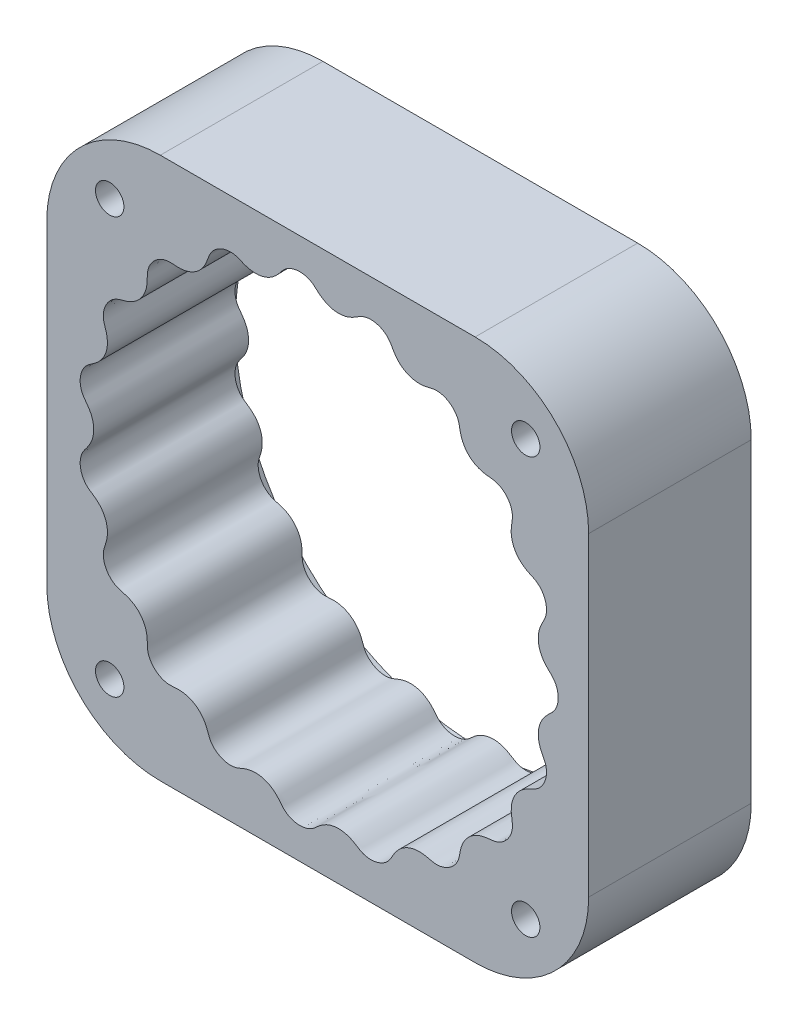
from build123d import *

# Parameters (mm, degrees)
BOSS_EXTRUDE1_START     = -15
BOSS_EXTRUDE1_OUTLINE_W = 105
BOSS_EXTRUDE1_OUTLINE_H = 105
BOSS_EXTRUDE1_DEPTH     = 30
FILLET1_R               = 22
SKETCH3_R               = 47.5
BOSS_EXTRUDE2_DEPTH     = 1.5
M5_CLEARANCE_HOLE1_D    = 5.5


# Read off the part's stored shape, not the designer's step: Boss-Extrude1
with BuildPart() as part:
    # Boss-Extrude1 outline → Boss-Extrude1 (new body)
    with BuildSketch(Plane.XY.offset(BOSS_EXTRUDE1_START)):
        Rectangle(BOSS_EXTRUDE1_OUTLINE_W, BOSS_EXTRUDE1_OUTLINE_H)
        with BuildLine():
            add(Edge.make_bspline(
                [(46.6, 0), (46.6, 0.029087461), (46.599364612, 0.087257129), (46.596505374, 0.189641599), (46.588879748, 0.333882329), (46.577439121, 0.472245688), (46.562181605, 0.604872273), (46.543105311, 0.736757111), (46.520205715, 0.869043535), (46.486793745, 1.034170725), (46.439000291, 1.230350248), (46.353070581, 1.520585204), (46.187608886, 1.948385058), (45.914553276, 2.462387961), (45.539034763, 2.944331255), (45.129326083, 3.33695268), (44.714883503, 3.72361592), (44.198622495, 4.235491045), (43.580390842, 5.003267586), (43.019635917, 6.085802978), (42.70540379, 7.399867904), (42.709511206, 8.517145629), (42.869182264, 9.382721248), (43.072025934, 10.026910788), (43.246298223, 10.466491915), (43.448090078, 10.894056312), (43.668303415, 11.312056785), (43.890460635, 11.729115857), (44.081486543, 12.162206318), (44.230509691, 12.646282797), (44.322254654, 13.17793841), (44.350269351, 13.901303309), (44.225980004, 14.785484309), (43.876469959, 15.753952549), (43.328261092, 16.571354837), (42.768276951, 17.118887669), (42.275218646, 17.463336276), (41.905394974, 17.668576571), (41.521608513, 17.845226332), (41.135800326, 18.016913299), (40.659736215, 18.245477721), (40.000488409, 18.617770316), (39.211352323, 19.215530447), (38.390031463, 20.155740794), (37.755372598, 21.401023427), (37.481291974, 22.6293171), (37.470138146, 23.643544264), (37.553204291, 24.3880984), (37.628385857, 24.871024236), (37.689307277, 25.25722304), (37.742949817, 25.743362292), (37.736273109, 26.407348831), (37.569014003, 27.23186091), (37.142972639, 28.180724435), (36.537210357, 28.966027778), (35.883456351, 29.532147771), (35.277085835, 29.895071779), (34.793981515, 30.10527269), (34.319162875, 30.244730454), (33.863161615, 30.323576928), (33.40313321, 30.366596235), (32.943171832, 30.408516422), (32.484935629, 30.468628109), (32.03098993, 30.556165837), (31.349481898, 30.737428845), (30.468549449, 31.097990168), (29.517636227, 31.727587687), (28.726402343, 32.591405442), (28.227269822, 33.404807425), (27.928053926, 34.083475509), (27.741981913, 34.646648529), (27.621495158, 35.151246838), (27.540892191, 35.588105319), (27.46407256, 36.025537396), (27.369150784, 36.504337733), (27.180106222, 37.082688092), (26.833292886, 37.722160757), (26.352791657, 38.324287786), (25.720738212, 38.890346654), (24.928043822, 39.373543485), (24.047894654, 39.686381568), (23.215360253, 39.78729997), (22.554927394, 39.741939088), (22.076027287, 39.650264034), (21.697241263, 39.55831848), (21.223758534, 39.443418722), (20.491270286, 39.297697162), (19.483061541, 39.221365323), (18.237383811, 39.38671866), (16.9412821, 39.909449178), (15.931398173, 40.646304358), (15.265420547, 41.382957669), (14.836701001, 42.009807629), (14.567886647, 42.466205551), (14.364116276, 42.8375367), (14.156406596, 43.206851773), (13.92202596, 43.560461381), (13.629057317, 43.916130741), (13.27011591, 44.260374073), (12.727767821, 44.664759759), (11.948159371, 45.061481341), (11.09271343, 45.294077816), (10.202357254, 45.34680237), (9.485549687, 45.261338322), (8.964345806, 45.12813622), (8.494853492, 44.941959947), (8.079335521, 44.71804952), (7.68280732, 44.463457476), (7.285877828, 44.209748252), (6.878169469, 43.97304101), (6.456372041, 43.762329426), (5.833872308, 43.505386686), (4.987909175, 43.271745962), (3.876320491, 43.169819966), (2.539162677, 43.367535142), (1.409790188, 43.832381738), (0.588840645, 44.384000745), (0.033206999, 44.856327151), (-0.317522366, 45.17488567), (-0.600518674, 45.427162793), (-0.972085052, 45.721875048), (-1.527217323, 46.062503501), (-2.303235928, 46.359067305), (-3.298726206, 46.505710733), (-4.380312925, 46.418186837), (-5.336697925, 46.114804242), (-6.051490182, 45.701544497), (-6.543432506, 45.28061924), (-6.862182092, 44.93308185), (-7.099467465, 44.640145681), (-7.390965094, 44.270087148), (-7.85580291, 43.714144886), (-8.564983, 43.034238721), (-9.645305925, 42.348851824), (-11.053671018, 41.900713757), (-12.399361948, 41.847716086), (-13.477212764, 42.054859944), (-14.248747763, 42.321200786), (-14.748329849, 42.528078612), (-15.144725128, 42.700651944), (-15.54804898, 42.857976029), (-15.964827464, 42.976465966), (-16.424561869, 43.054831219), (-16.923509929, 43.080933138), (-17.596231206, 43.034608683), (-18.424859211, 42.836591729), (-19.330531401, 42.418208159), (-20.084149678, 41.819645132), (-20.583925648, 41.219723741), (-20.887529946, 40.702592125), (-21.062460409, 40.318882171), (-21.207179109, 39.923272014), (-21.345795171, 39.525730848), (-21.532751901, 39.033537922), (-21.846234916, 38.346942265), (-22.371718452, 37.51158873), (-23.235224483, 36.612351462), (-24.420037522, 35.870640193), (-25.621445103, 35.489625147), (-26.634100057, 35.390458765), (-27.385338694, 35.409912071), (-27.874415543, 35.444435486), (-28.265423903, 35.473940863), (-28.657808638, 35.485591011), (-29.049922684, 35.462778276), (-29.609443499, 35.375052303), (-30.317114974, 35.149276757), (-31.143352348, 34.695078612), (-31.877513229, 34.027785471), (-32.388692105, 33.331175607), (-32.701134403, 32.699553889), (-32.871878953, 32.202639001), (-32.97315823, 31.719649794), (-33.015706635, 31.260070917), (-33.021315439, 30.799307278), (-33.02466199, 30.338714031), (-33.045665963, 29.878295211), (-33.093911831, 29.419780471), (-33.215495563, 28.727116861), (-33.497441819, 27.820770261), (-34.040704398, 26.819690287), (-34.831315921, 25.956095904), (-35.598629525, 25.387101875), (-36.250805729, 25.028894083), (-36.797567632, 24.794179621), (-37.291610194, 24.630493146), (-37.721505444, 24.513048501), (-38.152484082, 24.400066194), (-38.623629338, 24.266873639), (-39.187164279, 24.032432169), (-39.799081301, 23.634769785), (-40.36260276, 23.106034759), (-40.876472492, 22.429627339), (-41.293889066, 21.600960829), (-41.534535207, 20.700182313), (-41.568863522, 19.864910481), (-41.472077943, 19.212101178), (-41.343195847, 18.743379247), (-41.221082694, 18.374466146), (-41.067537268, 17.913659669), (-40.860647334, 17.198463746), (-40.697949644, 16.20379394), (-40.752236204, 14.982678894), (-41.130058644, 13.706086002), (-41.724378981, 12.666920056), (-42.346630019, 11.949944985), (-42.914545599, 11.453911918), (-43.36570477, 11.12002078), (-43.737705228, 10.868799961), (-44.112515882, 10.621938918), (-44.473001401, 10.353649668), (-44.937026241, 9.925564315), (-45.432780332, 9.276484551), (-45.85982989, 8.361475204), (-46.054645226, 7.332730317), (-46.035304424, 6.433680211), (-45.893339269, 5.728053082), (-45.719711363, 5.220475217), (-45.497784051, 4.768435111), (-45.242562272, 4.372936441), (-44.95746402, 3.999425043), (-44.672243636, 3.626196511), (-44.40255798, 3.241183513), (-44.157159078, 2.84014718), (-43.848370672, 2.243882141), (-43.542926044, 1.423779601), (-43.349852638, 0.35773357), (-43.41587872, -0.928193685), (-43.73968724, -2.052127744), (-44.170903187, -2.895110464), (-44.576050773, -3.495305807), (-44.879637417, -3.89865098), (-45.126068462, -4.218516436), (-45.35995448, -4.5481038), (-45.564196947, -4.897255034), (-45.748344007, -5.300034028), (-45.898352022, -5.757510539), (-46.028291706, -6.404246465), (-46.056011502, -7.232679593), (-45.90360822, -8.181146762), (-45.52189926, -9.116043895), (-45.054559895, -9.793605367), (-44.597609809, -10.24958302), (-44.227060272, -10.539109333), (-43.916808035, -10.751390924), (-43.52497417, -11.010478179), (-42.933523203, -11.425186638), (-42.197462177, -12.070967255), (-41.440263105, -13.061334193), (-40.885173083, -14.362848438), (-40.692886921, -15.644152631), (-40.767518554, -16.697924706), (-40.942569439, -17.489922394), (-41.107078592, -18.036262169), (-41.253264472, -18.468374312), (-41.393334913, -18.902831626), (-41.495247263, -19.348527803), (-41.549342916, -19.834203374), (-41.543240717, -20.354477429), (-41.447101521, -21.045513367), (-41.182339935, -21.872942564), (-40.688480135, -22.753100501), (-40.026775362, -23.461012396), (-39.390948583, -23.910155699), (-38.853107879, -24.171270732), (-38.457982178, -24.314997399), (-38.053197956, -24.42708195), (-37.64675139, -24.531900087), (-37.142038149, -24.676194717), (-36.433328318, -24.928930554), (-35.558308552, -25.37866609), (-34.612604024, -26.139482406), (-33.800095265, -27.197967509), (-33.310413145, -28.303671653), (-33.100747534, -29.256890066), (-33.035961406, -30.000647108), (-33.022448287, -30.521436434), (-33.020934216, -30.93802916), (-33.009240784, -31.354767139), (-32.963258516, -31.769568685), (-32.867143359, -32.212481315), (-32.70932044, -32.675502609), (-32.420302687, -33.274873428), (-31.925261302, -33.974666151), (-31.293487791, -34.568413067), (-30.55221464, -35.025449505), (-29.899465003, -35.285698973), (-29.391987449, -35.416124968), (-28.903859788, -35.478809394), (-28.443598193, -35.485005889), (-27.985109803, -35.453423757), (-27.527108489, -35.418415053), (-27.067822527, -35.400390013), (-26.608126306, -35.409213019), (-25.909508979, -35.47055211), (-24.98474332, -35.672196203), (-24.058287402, -36.074386773), (-23.195282906, -36.694531458), (-22.580291821, -37.315387153), (-22.157905423, -37.859866122), (-21.794223425, -38.462181376), (-21.532014308, -39.028926658), (-21.340816844, -39.539132067), (-21.187475413, -39.979029037), (-21.056859249, -40.328370888), (-20.864525811, -40.753337701), (-20.531775511, -41.300446627), (-19.989267547, -41.910606678), (-19.186680674, -42.495885748), (-18.198742075, -42.920563184), (-17.211451966, -43.100880124), (-16.378692256, -43.068800628), (-15.737516589, -42.921511161), (-15.281814566, -42.756475638), (-14.925149692, -42.60523728), (-14.480127692, -42.414385226), (-13.787294208, -42.148238149), (-12.813514375, -41.900951627), (-11.610585016, -41.8490742), (-10.337588254, -42.101694414), (-9.371648719, -42.533226002), (-8.689955807, -42.983804945), (-8.196993057, -43.400015536), (-7.857883944, -43.732357261), (-7.541689551, -44.086448454), (-7.243389355, -44.455410771), (-6.951486554, -44.829275853), (-6.637732453, -45.186083686), (-6.161065809, -45.618271953), (-5.471404128, -46.052289652), (-4.531729166, -46.394678261), (-3.506503098, -46.501851967), (-2.620959945, -46.411145903), (-1.930900495, -46.213866602), (-1.440101883, -46.001165413), (-1.008199144, -45.745055861), (-0.635068333, -45.460312519), (-0.286844081, -45.146791783), (0.060207743, -44.832270735), (0.419910008, -44.531752914), (0.797329731, -44.25367963), (1.363115268, -43.89565228), (2.151225627, -43.521133486), (3.069293267, -43.270129879), (4.090579929, -43.200885347), (4.980606689, -43.29020225), (5.727321282, -43.469288679), (6.350058033, -43.707681041), (6.855325115, -43.960392245), (7.256207697, -44.193670366), (7.56371739, -44.386746445), (7.868672957, -44.583634275), (8.178964683, -44.772524983), (8.582222823, -44.981743841), (9.166600108, -45.201750997), (9.949755718, -45.347735369), (10.923921168, -45.323373972), (11.952107252, -45.065605809), (12.833911886, -44.619777654), (13.470166718, -44.101700977), (13.887500425, -43.61186031), (14.146152239, -43.220867431), (14.332190277, -42.895531723), (14.557243566, -42.484873602), (14.919162012, -41.862371902), (15.497147725, -41.075873712), (16.4161953, -40.236326862), (17.663787326, -39.569177797), (18.924969634, -39.265079517), (19.984296654, -39.248036928), (20.790665402, -39.354825599), (21.350506246, -39.472829745), (21.794510371, -39.582831296), (22.240028089, -39.68772929), (22.693582681, -39.754434092), (23.183377617, -39.770095592), (23.702981116, -39.722604435), (24.386071642, -39.571145789), (25.190286121, -39.240311492), (26.027383048, -38.677318298), (26.678987062, -37.961788991), (27.074960175, -37.294299359), (27.292215643, -36.739219006), (27.404045113, -36.335200727), (27.483006235, -35.92392845), (27.553549291, -35.511428803), (27.654424697, -34.997885182), (27.844965155, -34.272385809), (28.216031148, -33.364564212), (28.890156642, -32.357356991), (29.873150236, -31.454965885), (30.93330336, -30.86952139), (31.867741284, -30.577154216), (32.605510667, -30.448558397), (33.124863271, -30.391003117), (33.541144212, -30.354903797), (33.956818374, -30.309694973), (34.367931711, -30.230977638), (34.803195622, -30.099848837), (35.253601598, -29.90522522), (35.829727895, -29.568264887), (36.488107619, -29.017933528), (37.028982636, -28.340300749), (37.42448219, -27.565387247), (37.631175985, -26.895822302), (37.720680075, -26.381032737), (37.744597382, -25.890842805), (37.714613789, -25.432758415), (37.646300663, -24.979522235), (37.573425558, -24.527290993), (37.516725603, -24.072414827), (37.486293382, -23.614930216), (37.487260776, -22.915541514), (37.607562747, -21.979511393), (37.981612168, -20.85779432), (38.75276426, -19.671691071), (39.666787707, -18.828038809), (40.49797482, -18.319456761), (41.147514954, -18.011443702), (41.574633246, -17.821431654), (41.913461312, -17.662773755), (42.323315352, -17.436839115), (42.844274796, -17.060923449), (43.411203534, -16.469707776), (43.926938672, -15.627817301), (44.267717023, -14.624106896), (44.371412297, -13.654409652), (44.289189571, -12.86067167), (44.116674888, -12.259464523), (43.940306734, -11.83997082), (43.777015952, -11.514793846), (43.562751259, -11.113971502), (43.309988076, -10.619280631), (43.05517887, -10.013283664), (42.844797238, -9.283975605), (42.729731478, -8.52355349), (42.715951334, -7.579290135), (42.900450934, -6.470843349), (43.332715359, -5.412563918), (43.929519137, -4.551669803), (44.45547596, -3.977875104), (44.82489899, -3.620051543), (45.126415876, -3.340387906), (45.421283365, -3.053265717), (45.69235234, -2.743053666), (45.950494641, -2.378605209), (46.149409688, -2.017298355), (46.298553136, -1.66994977), (46.396529934, -1.377009003), (46.451827543, -1.178574091), (46.491256037, -1.01123335), (46.518796895, -0.876853704), (46.542321479, -0.742815133), (46.561861492, -0.608228856), (46.577557899, -0.468108615), (46.589452906, -0.321119434), (46.595248795, -0.216114461), (46.597500878, -0.156808149), (46.598296327, -0.127135709)],
                knots=[0.067476216, 0.067476216, 0.067476216, 0.067476216, 0.067476216, 0.067844778, 0.06821334, 0.068581902, 0.068950464, 0.069319026, 0.069687588, 0.07005615, 0.070424712, 0.071161836, 0.07189896, 0.073373208, 0.075444729, 0.077516251, 0.078552011, 0.079587772, 0.081659293, 0.085482409, 0.089305525, 0.092815775, 0.096326026, 0.097620812, 0.098915599, 0.100210386, 0.101505173, 0.10279996, 0.104094747, 0.105389533, 0.10668432, 0.108337983, 0.109991645, 0.11329897, 0.116406241, 0.119513511, 0.120670895, 0.121828278, 0.122985661, 0.124143044, 0.125300428, 0.126457811, 0.128772577, 0.132431495, 0.136090414, 0.14001233, 0.143934247, 0.146077059, 0.147148466, 0.148219872, 0.149291278, 0.150362685, 0.152505497, 0.155469761, 0.158434024, 0.161661995, 0.163275981, 0.164889966, 0.166155807, 0.167421649, 0.16868749, 0.169953331, 0.171219172, 0.172485013, 0.173750854, 0.175016695, 0.178942369, 0.182868043, 0.186114094, 0.18773712, 0.189360146, 0.190983171, 0.192606197, 0.19341771, 0.194229223, 0.195852249, 0.197953333, 0.200054417, 0.202155501, 0.204256585, 0.207211813, 0.210167041, 0.212303246, 0.213371348, 0.214439451, 0.215507554, 0.216575656, 0.218711861, 0.222621737, 0.226531614, 0.230201837, 0.233872061, 0.23619377, 0.237354625, 0.238515479, 0.239676334, 0.240837188, 0.241998043, 0.243158898, 0.244717084, 0.24627527, 0.249391642, 0.252689694, 0.254338719, 0.255987745, 0.257278834, 0.258569922, 0.259861011, 0.261152099, 0.262443188, 0.263734276, 0.265025365, 0.266316453, 0.269816729, 0.273317005, 0.277153187, 0.280989369, 0.283066851, 0.284105593, 0.285144334, 0.286183075, 0.287221816, 0.289299299, 0.292256842, 0.295214385, 0.298153847, 0.301093309, 0.303158909, 0.30419171, 0.30522451, 0.30625731, 0.30729011, 0.30935571, 0.313165725, 0.31697574, 0.321172792, 0.325369844, 0.327740076, 0.328925192, 0.330110308, 0.331295425, 0.332480541, 0.333665657, 0.334850773, 0.336397317, 0.33794386, 0.341036948, 0.344135088, 0.347233227, 0.348387151, 0.349541074, 0.350694997, 0.351848921, 0.353002844, 0.354156767, 0.356464614, 0.360112192, 0.36375977, 0.367693703, 0.371627635, 0.373777085, 0.37485181, 0.375926534, 0.377001259, 0.378075984, 0.379150709, 0.380225434, 0.383198716, 0.386171998, 0.389391084, 0.391000627, 0.39261017, 0.393872574, 0.395134978, 0.396397382, 0.397659786, 0.39892219, 0.400184594, 0.401446998, 0.402709403, 0.406624153, 0.410538904, 0.41379527, 0.415423454, 0.417051637, 0.418679821, 0.420308004, 0.421122096, 0.421936187, 0.423564371, 0.425671917, 0.427779464, 0.429887011, 0.431994558, 0.434940736, 0.437886914, 0.440016543, 0.441081358, 0.442146172, 0.443210987, 0.444275801, 0.44640543, 0.450303242, 0.454201053, 0.457531125, 0.460861197, 0.463321098, 0.464551048, 0.465780999, 0.467010949, 0.4682409, 0.46947085, 0.4707008, 0.47391528, 0.47712976, 0.480418499, 0.482062869, 0.483707238, 0.484994631, 0.486282023, 0.487569416, 0.488856808, 0.490144201, 0.491431593, 0.492718986, 0.494006378, 0.497496655, 0.500986931, 0.504491141, 0.507995351, 0.51020864, 0.511315284, 0.512421929, 0.513528573, 0.514635217, 0.515741862, 0.516848506, 0.518374532, 0.519900559, 0.522952611, 0.525883037, 0.528813462, 0.530873193, 0.531903058, 0.532932923, 0.533962788, 0.534992653, 0.537052383, 0.540849262, 0.544646141, 0.548521961, 0.552397781, 0.554898446, 0.556148779, 0.557399111, 0.558649443, 0.559899776, 0.561150108, 0.562400441, 0.563994159, 0.565587878, 0.568775315, 0.571864297, 0.574953278, 0.576103754, 0.577254229, 0.578404705, 0.579555181, 0.580705656, 0.581856132, 0.584157083, 0.587793287, 0.591429492, 0.595036866, 0.59864424, 0.600927916, 0.602069755, 0.603211593, 0.604353431, 0.605495269, 0.606637107, 0.607778946, 0.609311832, 0.610844718, 0.61391049, 0.617120645, 0.618725722, 0.6203308, 0.621589771, 0.622848742, 0.624107712, 0.625366683, 0.626625654, 0.627884625, 0.629143596, 0.630402567, 0.634306336, 0.638210106, 0.640094005, 0.641977905, 0.643861805, 0.645745704, 0.647788764, 0.648810294, 0.649831824, 0.650853354, 0.651874883, 0.653917943, 0.656825574, 0.659733204, 0.662670319, 0.665607435, 0.667730522, 0.668792065, 0.669853608, 0.670915152, 0.671976695, 0.674099782, 0.677985502, 0.681871223, 0.685034802, 0.688198381, 0.689498395, 0.690798408, 0.692098422, 0.693398435, 0.694698449, 0.695998462, 0.697298476, 0.698598489, 0.701733373, 0.704868257, 0.708147647, 0.709787342, 0.711427036, 0.712710736, 0.713994435, 0.715278134, 0.716561833, 0.717845533, 0.719129232, 0.720412931, 0.72169663, 0.725176884, 0.728657138, 0.730755052, 0.732852966, 0.73495088, 0.737048794, 0.73804371, 0.739038626, 0.740033543, 0.741028459, 0.742023375, 0.743018291, 0.745008124, 0.74784953, 0.750690936, 0.753612324, 0.756533711, 0.758587037, 0.759613701, 0.760640364, 0.761667027, 0.76269369, 0.764747016, 0.768531899, 0.772316781, 0.776203724, 0.780090667, 0.782598174, 0.783851927, 0.78510568, 0.786359434, 0.787613187, 0.78886694, 0.790120694, 0.791718932, 0.79331717, 0.796513645, 0.799593443, 0.802673241, 0.803820282, 0.804967323, 0.806114364, 0.807261404, 0.808408445, 0.809555486, 0.811849567, 0.815474365, 0.819099164, 0.822717992, 0.82633682, 0.828627324, 0.829772576, 0.830917829, 0.832063081, 0.833208333, 0.834353585, 0.835498837, 0.837036333, 0.838573829, 0.841648821, 0.844850001, 0.846450591, 0.848051181, 0.849306723, 0.850562265, 0.851817807, 0.85307335, 0.854328892, 0.855584434, 0.856839976, 0.858095519, 0.861988249, 0.86588098, 0.869660006, 0.873439032, 0.875488823, 0.876513719, 0.877538615, 0.878563511, 0.879588406, 0.881638198, 0.884554865, 0.887471532, 0.890317551, 0.893163569, 0.895156765, 0.896153363, 0.897149961, 0.898146559, 0.899143157, 0.901136353, 0.903237521, 0.905338689, 0.907439857, 0.909541025, 0.913556011, 0.917570996, 0.919825422, 0.920952635, 0.922079847, 0.92320706, 0.924334273, 0.925461486, 0.926588698, 0.928093135, 0.928845354, 0.929597572, 0.929973681, 0.930349791, 0.9307259, 0.931102009, 0.931478118, 0.931854227, 0.932230337, 0.932606446, 0.932606446, 0.932606446, 0.932606446, 0.932606446], degree=4))
            ThreePointArc((46.6, 0), (46.599574063, -0.063573562), (46.598296327, -0.127135709))
        make_face(mode=Mode.SUBTRACT)
    extrude(amount=BOSS_EXTRUDE1_DEPTH)

    # Fillet1
    fillet1_edges = [part.edges().sort_by_distance(p)[0] for p in [
        (52.5, -52.5, 0),
        (-52.5, -52.5, 0),
        (-52.5, 52.5, 0),
        (52.5, 52.5, 0),
    ]]
    fillet(fillet1_edges, radius=FILLET1_R)

    # Sketch3 → Boss-Extrude2 (add)
    with BuildSketch(Plane(origin=(0, 0, -15), x_dir=(-1, 0, 0), z_dir=(0, 0, -1))):
        with BuildLine():
            Line((-52.5, 30.5), (-52.5, -30.5))
            ThreePointArc((-52.5, -30.5), (-46.056349186, -46.056349186), (-30.5, -52.5))
            Line((-30.5, -52.5), (30.5, -52.5))
            ThreePointArc((30.5, -52.5), (46.056349186, -46.056349186), (52.5, -30.5))
            Line((52.5, -30.5), (52.5, 30.5))
            ThreePointArc((52.5, 30.5), (46.056349186, 46.056349186), (30.5, 52.5))
            Line((30.5, 52.5), (-30.5, 52.5))
            ThreePointArc((-30.5, 52.5), (-46.056349186, 46.056349186), (-52.5, 30.5))
        make_face()
        Circle(SKETCH3_R, mode=Mode.SUBTRACT)
    extrude(amount=BOSS_EXTRUDE2_DEPTH)

    # M5 Clearance Hole1 (through all)
    with Locations(Plane.XY.offset(15)):
        with Locations((-40.305086528, 40.305086528), (40.305086528, 40.305086528), (40.305086528, -40.305086528), (-40.305086528, -40.305086528)):
            Hole(M5_CLEARANCE_HOLE1_D / 2)


solid = part.part
